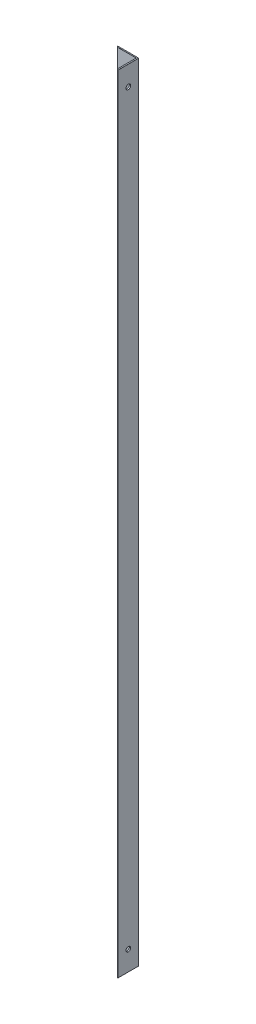
from build123d import *

# Parameters (mm, degrees)
EXTRUDE_1_DEPTH        = 2000
FILLET_1_R             = 0.1
SKETCH_2_R             = 6
CUT_EXTRUDE_1_DEPTH    = 200
SKETCH_5_R             = 6
CUT_EXTRUDE_2_DEPTH    = 200
PATTERN_LINEAR_1_COUNT = 2
PATTERN_LINEAR_1_PITCH = 1900


with BuildPart() as part:
    # 草图1 → 凸台-拉伸1 (new body)
    with BuildSketch(Plane(origin=(0, 0, 0), x_dir=(1, 0, 0), z_dir=(0, 1, 0))):
        with BuildLine():
            ThreePointArc((-29.759542218, 3), (-28.958115236, 0.95539927), (-26.980771162, 0))
            Line((-26.980771162, 0), (-26.520700364, 0))
            Line((-26.520700364, 0), (20.240457782, 0))
            Line((20.240457782, 0), (20.240457782, -46.555391571))
            ThreePointArc((20.240457782, -46.555391571), (21.249360232, -48.99109755), (23.68506621, -50))
            Line((23.68506621, -50), (23.68506621, 3))
            Line((23.68506621, 3), (-29.759542218, 3))
        make_face()
    extrude(amount=EXTRUDE_1_DEPTH)

    # 圆角1
    # the kernel refuses this fillet: 0.1 mm, written as the material it takes off along each edge
    with BuildSketch(Plane(origin=(24.28506621, 2000, -3), x_dir=(0, 0, 1), z_dir=(-1, 0, 0))) as fillet_1_piece_1:
        with BuildLine():
            CenterArc((FILLET_1_R, -FILLET_1_R), FILLET_1_R, 90, 90)
            Line((0, -FILLET_1_R), (-FILLET_1_R * 0.02, -FILLET_1_R))
            Line((-FILLET_1_R * 0.02, -FILLET_1_R), (-FILLET_1_R * 0.02, FILLET_1_R * 0.0199999999995))
            Line((-FILLET_1_R * 0.02, FILLET_1_R * 0.0199999999995), (FILLET_1_R, FILLET_1_R * 0.0199999999995))
            Line((FILLET_1_R, FILLET_1_R * 0.0199999999995), (FILLET_1_R, 0))
        make_face()
    extrude(amount=54.644608429, mode=Mode.SUBTRACT)
    with BuildSketch(Plane(origin=(20.240457782, 2000, 0), x_dir=(0, 0, -1), z_dir=(-1, 0, 0)), Plane(origin=(-27.580771162, 0, 0), x_dir=(0, 0, -1), z_dir=(1, 0, 0))) as fillet_1_piece_2:
        with BuildLine():
            CenterArc((FILLET_1_R, FILLET_1_R), FILLET_1_R, 180, 90)
            Line((0, FILLET_1_R), (-FILLET_1_R * 0.02, FILLET_1_R))
            Line((-FILLET_1_R * 0.02, FILLET_1_R), (-FILLET_1_R * 0.02, -FILLET_1_R * 0.0199999999995))
            Line((-FILLET_1_R * 0.02, -FILLET_1_R * 0.0199999999995), (FILLET_1_R, -FILLET_1_R * 0.0199999999995))
            Line((FILLET_1_R, -FILLET_1_R * 0.0199999999995), (FILLET_1_R, 0))
        make_face()
    extrude(amount=47.821228944, mode=Mode.SUBTRACT)
    with BuildSketch(Plane(origin=(20.240457782, 2000, 0), x_dir=(1, 0, 0), z_dir=(0, 0, 1)), Plane(origin=(20.240457782, 0, 0), x_dir=(0, 1, 0), z_dir=(0, 0, 1))) as fillet_1_piece_3:
        with BuildLine():
            CenterArc((FILLET_1_R, -FILLET_1_R), FILLET_1_R, 90, 90)
            Line((0, -FILLET_1_R), (-FILLET_1_R * 0.02, -FILLET_1_R))
            Line((-FILLET_1_R * 0.02, -FILLET_1_R), (-FILLET_1_R * 0.02, FILLET_1_R * 0.0199999999995))
            Line((-FILLET_1_R * 0.02, FILLET_1_R * 0.0199999999995), (FILLET_1_R, FILLET_1_R * 0.0199999999995))
            Line((FILLET_1_R, FILLET_1_R * 0.0199999999995), (FILLET_1_R, 0))
        make_face()
    extrude(amount=46.555391571, mode=Mode.SUBTRACT)
    with BuildSketch(Plane(origin=(23.68506621, 2000, 46.555391571), x_dir=(-1, 0, 0), z_dir=(0, 0, -1))) as fillet_1_piece_4:
        with BuildLine():
            CenterArc((3.444608429 - FILLET_1_R, -FILLET_1_R), FILLET_1_R, 0, 90)
            Line((3.444608429, -FILLET_1_R), (3.444608429 + FILLET_1_R * 0.02, -FILLET_1_R))
            Line((3.444608429 + FILLET_1_R * 0.02, -FILLET_1_R), (3.444608429 + FILLET_1_R * 0.02, FILLET_1_R * 0.0199999999995))
            Line((3.444608429 + FILLET_1_R * 0.02, FILLET_1_R * 0.0199999999995), (3.444608429 - FILLET_1_R, FILLET_1_R * 0.0199999999995))
            Line((3.444608429 - FILLET_1_R, FILLET_1_R * 0.0199999999995), (3.444608429 - FILLET_1_R, 0))
        make_face()
    revolve(axis=Axis((23.68506621, 2000, 46.555391571), (0, 1, 0)), revolution_arc=99.984089086, mode=Mode.SUBTRACT)
    with BuildSketch(Plane(origin=(24.28506621, 0, -3), x_dir=(0, 0, 1), z_dir=(-1, 0, 0))) as fillet_1_piece_5:
        with BuildLine():
            CenterArc((FILLET_1_R, FILLET_1_R), FILLET_1_R, 180, 90)
            Line((0, FILLET_1_R), (-FILLET_1_R * 0.02, FILLET_1_R))
            Line((-FILLET_1_R * 0.02, FILLET_1_R), (-FILLET_1_R * 0.02, -FILLET_1_R * 0.02))
            Line((-FILLET_1_R * 0.02, -FILLET_1_R * 0.02), (FILLET_1_R, -FILLET_1_R * 0.02))
            Line((FILLET_1_R, -FILLET_1_R * 0.02), (FILLET_1_R, 0))
        make_face()
    extrude(amount=54.644608429, mode=Mode.SUBTRACT)
    with BuildSketch(Plane(origin=(23.68506621, 2000, 50.6), x_dir=(-1, 0, 0), z_dir=(0, 0, -1)), Plane(origin=(23.68506621, 0, 50.6), x_dir=(0, 1, 0), z_dir=(0, 0, -1))) as fillet_1_piece_6:
        with BuildLine():
            CenterArc((FILLET_1_R, -FILLET_1_R), FILLET_1_R, 90, 90)
            Line((0, -FILLET_1_R), (-FILLET_1_R * 0.02, -FILLET_1_R))
            Line((-FILLET_1_R * 0.02, -FILLET_1_R), (-FILLET_1_R * 0.02, FILLET_1_R * 0.0199999999995))
            Line((-FILLET_1_R * 0.02, FILLET_1_R * 0.0199999999995), (FILLET_1_R, FILLET_1_R * 0.0199999999995))
            Line((FILLET_1_R, FILLET_1_R * 0.0199999999995), (FILLET_1_R, 0))
        make_face()
    extrude(amount=54.2, mode=Mode.SUBTRACT)
    with BuildSketch(Plane(origin=(23.68506621, 0, 46.555391571), x_dir=(-1, 0, 0), z_dir=(0, 0, -1))) as fillet_1_piece_7:
        with BuildLine():
            CenterArc((3.444608429 - FILLET_1_R, FILLET_1_R), FILLET_1_R, 270, 90)
            Line((3.444608429 - FILLET_1_R, 0), (3.444608429 - FILLET_1_R, -FILLET_1_R * 0.02))
            Line((3.444608429 - FILLET_1_R, -FILLET_1_R * 0.02), (3.444608429 + FILLET_1_R * 0.02, -FILLET_1_R * 0.02))
            Line((3.444608429 + FILLET_1_R * 0.02, -FILLET_1_R * 0.02), (3.444608429 + FILLET_1_R * 0.02, FILLET_1_R))
            Line((3.444608429 + FILLET_1_R * 0.02, FILLET_1_R), (3.444608429, FILLET_1_R))
        make_face()
    revolve(axis=Axis((23.68506621, 0, 46.555391571), (0, 1, 0)), revolution_arc=99.984089086, mode=Mode.SUBTRACT)
    with BuildSketch(Plane(origin=(20.840457782, 2000, 0), x_dir=(0, 0, -1), z_dir=(-1, 0, 0))) as fillet_1_piece_8a_section:
        with BuildLine():
            CenterArc((FILLET_1_R, FILLET_1_R), FILLET_1_R, 180, 90)
            Line((0, FILLET_1_R), (-FILLET_1_R * 0.02, FILLET_1_R))
            Line((-FILLET_1_R * 0.02, FILLET_1_R), (-FILLET_1_R * 0.02, -FILLET_1_R * 0.0199999999995))
            Line((-FILLET_1_R * 0.02, -FILLET_1_R * 0.0199999999995), (FILLET_1_R, -FILLET_1_R * 0.0199999999995))
            Line((FILLET_1_R, -FILLET_1_R * 0.0199999999995), (FILLET_1_R, 0))
        make_face()
    fillet_1_piece_8a = extrude(amount=48.421228944, mode=Mode.PRIVATE)
    fillet_1_piece_8a = split(fillet_1_piece_8a, bisect_by=Plane(origin=(20.240457782, 1999.977360489, -0.022639511), z_dir=(1, 0, 0)), keep=Keep.TOP, mode=Mode.PRIVATE)
    with BuildSketch(Plane(origin=(20.240457782, 2000, -0.6), x_dir=(1, 0, 0), z_dir=(0, 0, 1))) as fillet_1_piece_8b_section:
        with BuildLine():
            CenterArc((FILLET_1_R, -FILLET_1_R), FILLET_1_R, 90, 90)
            Line((0, -FILLET_1_R), (-FILLET_1_R * 0.02, -FILLET_1_R))
            Line((-FILLET_1_R * 0.02, -FILLET_1_R), (-FILLET_1_R * 0.02, FILLET_1_R * 0.0199999999995))
            Line((-FILLET_1_R * 0.02, FILLET_1_R * 0.0199999999995), (FILLET_1_R, FILLET_1_R * 0.0199999999995))
            Line((FILLET_1_R, FILLET_1_R * 0.0199999999995), (FILLET_1_R, 0))
        make_face()
    fillet_1_piece_8b = extrude(amount=47.155391571, mode=Mode.PRIVATE)
    fillet_1_piece_8b = split(fillet_1_piece_8b, bisect_by=Plane(origin=(20.263097293, 1999.977360489, 0), z_dir=(0, 0, -1)), keep=Keep.TOP, mode=Mode.PRIVATE)
    fillet_1_piece_8 = fillet_1_piece_8a & fillet_1_piece_8b
    add(fillet_1_piece_8, mode=Mode.SUBTRACT)
    with BuildSketch(Plane(origin=(20.240457782, 0, -0.6), x_dir=(0, 1, 0), z_dir=(0, 0, 1))) as fillet_1_piece_9a_section:
        with BuildLine():
            CenterArc((FILLET_1_R, -FILLET_1_R), FILLET_1_R, 90, 90)
            Line((0, -FILLET_1_R), (-FILLET_1_R * 0.02, -FILLET_1_R))
            Line((-FILLET_1_R * 0.02, -FILLET_1_R), (-FILLET_1_R * 0.02, FILLET_1_R * 0.02))
            Line((-FILLET_1_R * 0.02, FILLET_1_R * 0.02), (FILLET_1_R, FILLET_1_R * 0.02))
            Line((FILLET_1_R, FILLET_1_R * 0.02), (FILLET_1_R, 0))
        make_face()
    fillet_1_piece_9a = extrude(amount=47.155391571, mode=Mode.PRIVATE)
    fillet_1_piece_9a = split(fillet_1_piece_9a, bisect_by=Plane(origin=(20.263097293, 0.022639511, 0), z_dir=(0, 0, -1)), keep=Keep.TOP, mode=Mode.PRIVATE)
    with BuildSketch(Plane(origin=(-27.580771162, 0, 0), x_dir=(0, 0, -1), z_dir=(1, 0, 0))) as fillet_1_piece_9b_section:
        with BuildLine():
            CenterArc((FILLET_1_R, FILLET_1_R), FILLET_1_R, 180, 90)
            Line((0, FILLET_1_R), (-FILLET_1_R * 0.02, FILLET_1_R))
            Line((-FILLET_1_R * 0.02, FILLET_1_R), (-FILLET_1_R * 0.02, -FILLET_1_R * 0.02))
            Line((-FILLET_1_R * 0.02, -FILLET_1_R * 0.02), (FILLET_1_R, -FILLET_1_R * 0.02))
            Line((FILLET_1_R, -FILLET_1_R * 0.02), (FILLET_1_R, 0))
        make_face()
    fillet_1_piece_9b = extrude(amount=48.421228944, mode=Mode.PRIVATE)
    fillet_1_piece_9b = split(fillet_1_piece_9b, bisect_by=Plane(origin=(20.240457782, 0.022639511, -0.022639511), z_dir=(1, 0, 0)), keep=Keep.TOP, mode=Mode.PRIVATE)
    fillet_1_piece_9 = fillet_1_piece_9a & fillet_1_piece_9b
    add(fillet_1_piece_9, mode=Mode.SUBTRACT)

    # 草图2 → 切除-拉伸1 (cut)
    with BuildSketch(Plane(origin=(23.68506621, 0, 0), x_dir=(0, 0, -1), z_dir=(1, 0, 0))):
        with Locations((-23.5, 50.1)):
            Circle(SKETCH_2_R)
        with Locations((-23.5, 1949.9)):
            Circle(SKETCH_2_R)
    extrude(amount=-CUT_EXTRUDE_1_DEPTH, mode=Mode.SUBTRACT)

    # 草图5 → 切除-拉伸2 (cut)
    with BuildSketch(Plane(origin=(0, 0, -3), x_dir=(-1, 0, 0), z_dir=(0, 0, -1))):
        with Locations((0, 50)):
            Circle(SKETCH_5_R)
    cut_extrude_2 = extrude(amount=-CUT_EXTRUDE_2_DEPTH, mode=Mode.SUBTRACT)

    # 阵列(线性)1: 切除-拉伸2 ×2
    with Locations(*[(0, i * PATTERN_LINEAR_1_PITCH, 0) for i in range(1, PATTERN_LINEAR_1_COUNT)]):
        add(cut_extrude_2, mode=Mode.SUBTRACT)


solid = part.part
